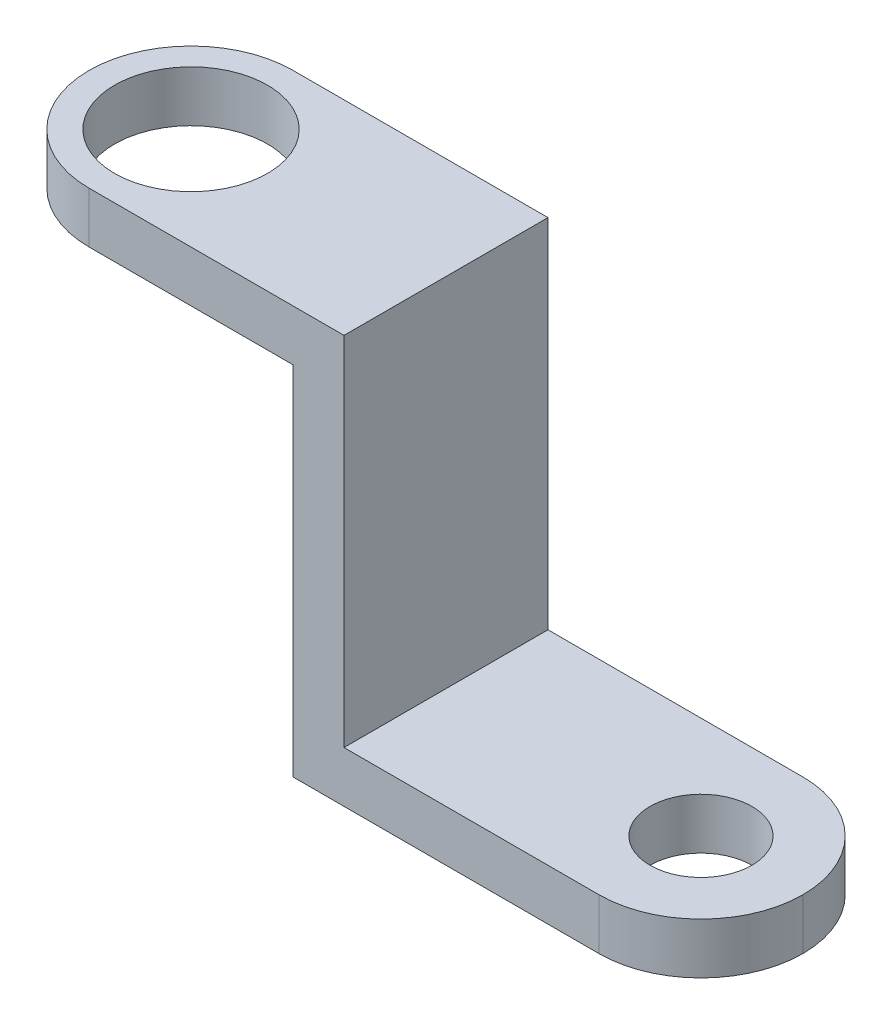
from build123d import *

# Parameters (mm, degrees)
BOSS_EXTRUDE1_DEPTH         = 25.4
FILLET1_R                   = 12.7
F_3_4_0_75_DIAMETER_HOLE1_D = 19.05
F_1_2_0_5_DIAMETER_HOLE2_D  = 12.7


with BuildPart() as part:
    # Sketch1 → Boss-Extrude1 (new body)
    with BuildSketch(Plane.XY):
        Polygon((-38.1, 44.45), (0, 44.45), (0, 0), (50.8, 0), (50.8, 6.35), (6.35, 6.35), (6.35, 50.8), (-38.1, 50.8), align=None)
    extrude(amount=BOSS_EXTRUDE1_DEPTH)

    # Fillet1
    fillet1_edges = [part.edges().sort_by_distance(p)[0] for p in [
        (50.8, 3.175, 0),
        (-38.1, 47.625, 0),
        (50.8, 3.175, 25.4),
        (-38.1, 47.625, 25.4),
    ]]
    fillet(fillet1_edges, radius=FILLET1_R - 0.0001)  # a hair under: the kernel refuses the full size

    # 3/4 (0.75) Diameter Hole1 (through all)
    with Locations(Plane(origin=(0, 50.8, 0), x_dir=(1, 0, 0), z_dir=(0, 1, 0))):
        with Locations((-25.4, -12.7)):
            Hole(F_3_4_0_75_DIAMETER_HOLE1_D / 2)

    # 1/2 (0.5) Diameter Hole2 (through all)
    with Locations(Plane(origin=(0, 6.35, 0), x_dir=(1, 0, 0), z_dir=(0, 1, 0))):
        with Locations((38.1, -12.7)):
            Hole(F_1_2_0_5_DIAMETER_HOLE2_D / 2)


solid = part.part
